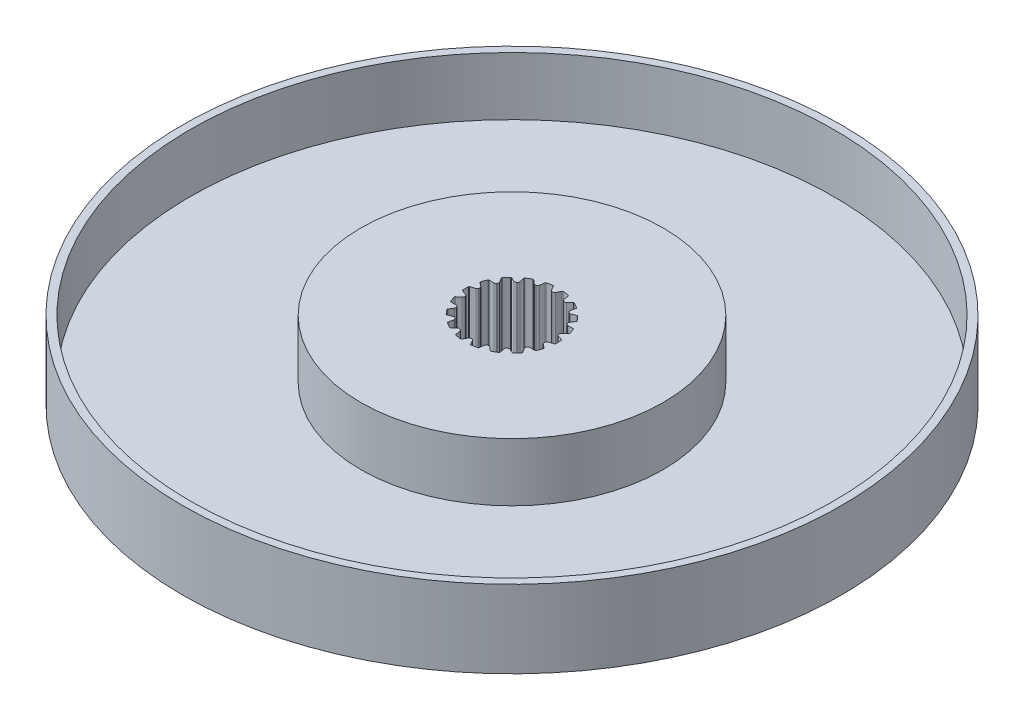
from build123d import *

# Parameters (mm, degrees)
SKETCH1_R           = 42.5
BOSS_EXTRUDE1_DEPTH = 10
SKETCH3_R           = 41.5
SKETCH3_R_2         = 19.5
CUT_EXTRUDE2_DEPTH  = 7.5
CUT_EXTRUDE4_DEPTH  = 61.930288035


with BuildPart() as part:
    # Sketch1 → Boss-Extrude1 (new body)
    with BuildSketch(Plane(origin=(0, 0, 0), x_dir=(1, 0, 0), z_dir=(0, 1, 0))):
        Circle(SKETCH1_R)
    extrude(amount=BOSS_EXTRUDE1_DEPTH)

    # Sketch3 → Cut-Extrude2 (cut)
    with BuildSketch(Plane(origin=(0, 10, 0), x_dir=(1, 0, 0), z_dir=(0, 1, 0))):
        Circle(SKETCH3_R)
        Circle(SKETCH3_R_2, mode=Mode.SUBTRACT)
    extrude(amount=-CUT_EXTRUDE2_DEPTH, mode=Mode.SUBTRACT)

    # Sketch4 → Cut-Extrude4 (cut, through all)
    with BuildSketch(Plane(origin=(0, 10, 0), x_dir=(1, 0, 0), z_dir=(0, 1, 0))):
        with BuildLine():
            Line((-0.270736898, 5.352657429), (-0.567299202, 5.910410003))
            ThreePointArc((-0.567299202, 5.910410003), (-0.608939663, 5.9519127), (-0.666705724, 5.962843573))
            ThreePointArc((-0.666705724, 5.962843573), (-1.041889066, 5.908846518), (-1.412914165, 5.831266892))
            ThreePointArc((-1.412914165, 5.831266892), (-1.463457927, 5.801238074), (-1.488392402, 5.74799642))
            Line((-1.488392402, 5.74799642), (-1.576307196, 5.122450161))
            ThreePointArc((-1.576307196, 5.122450161), (-1.629587723, 4.999913338), (-1.738369177, 4.922320281))
            Line((-1.738369177, 4.922320281), (-1.832338439, 4.888118266))
            ThreePointArc((-1.832338439, 4.888118266), (-1.965545724, 4.877634626), (-2.085126127, 4.937255215))
            Line((-2.085126127, 4.937255215), (-2.554566151, 5.359940911))
            ThreePointArc((-2.554566151, 5.359940911), (-2.607890142, 5.384698812), (-2.665911062, 5.375213317))
            ThreePointArc((-2.665911062, 5.375213317), (-3, 5.196152423), (-3.322115752, 4.996353363))
            ThreePointArc((-3.322115752, 4.996353363), (-3.359340892, 4.95084852), (-3.364561917, 4.892289638))
            Line((-3.364561917, 4.892289638), (-3.233225378, 4.274399803))
            ThreePointArc((-3.233225378, 4.274399803), (-3.241382634, 4.141029842), (-3.317065376, 4.03091077))
            Line((-3.317065376, 4.03091077), (-3.39366982, 3.966632009))
            ThreePointArc((-3.39366982, 3.966632009), (-3.515258106, 3.911221034), (-3.648018371, 3.926347156))
            Line((-3.648018371, 3.926347156), (-4.23371472, 4.162983841))
            ThreePointArc((-4.23371472, 4.162983841), (-4.292290582, 4.168010779), (-4.343568182, 4.139253006))
            ThreePointArc((-4.343568182, 4.139253006), (-4.596266659, 3.856725658), (-4.830621151, 3.55880588))
            ThreePointArc((-4.830621151, 3.55880588), (-4.850037767, 3.503313567), (-4.834915608, 3.446500522))
            Line((-4.834915608, 3.446500522), (-4.500168862, 2.910793746))
            ThreePointArc((-4.500168862, 2.910793746), (-4.462218963, 2.782677032), (-4.495674535, 2.65331393))
            Line((-4.495674535, 2.65331393), (-4.545674535, 2.56671139))
            ThreePointArc((-4.545674535, 2.56671139), (-4.640978481, 2.473056463), (-4.770905761, 2.441863683))
            Line((-4.770905761, 2.441863683), (-5.402214811, 2.463909481))
            ThreePointArc((-5.402214811, 2.463909481), (-5.45897743, 2.448599132), (-5.497326875, 2.404037693))
            ThreePointArc((-5.497326875, 2.404037693), (-5.638155725, 2.05212086), (-5.756482347, 1.692013886))
            ThreePointArc((-5.756482347, 1.692013886), (-5.755748509, 1.633227295), (-5.722107122, 1.585012579))
            Line((-5.722107122, 1.585012579), (-5.224325566, 1.196103005))
            ThreePointArc((-5.224325566, 1.196103005), (-5.144845829, 1.088692304), (-5.132038997, 0.955688272))
            Line((-5.132038997, 0.955688272), (-5.149403815, 0.857207497))
            ThreePointArc((-5.149403815, 0.857207497), (-5.206928358, 0.736604784), (-5.318351505, 0.662855412))
            Line((-5.318351505, 0.662855412), (-5.919128067, 0.467651274))
            ThreePointArc((-5.919128067, 0.467651274), (-5.967231035, 0.433850293), (-5.988026815, 0.378859955))
            ThreePointArc((-5.988026815, 0.378859955), (-6, 0), (-5.988026815, -0.378859955))
            ThreePointArc((-5.988026815, -0.378859955), (-5.967231035, -0.433850293), (-5.919128067, -0.467651274))
            Line((-5.919128067, -0.467651274), (-5.318351505, -0.662855412))
            ThreePointArc((-5.318351505, -0.662855412), (-5.206928358, -0.736604784), (-5.149403815, -0.857207497))
            Line((-5.149403815, -0.857207497), (-5.132038997, -0.955688272))
            ThreePointArc((-5.132038997, -0.955688272), (-5.144845829, -1.088692304), (-5.224325566, -1.196103005))
            Line((-5.224325566, -1.196103005), (-5.722107122, -1.585012579))
            ThreePointArc((-5.722107122, -1.585012579), (-5.755748509, -1.633227295), (-5.756482347, -1.692013886))
            ThreePointArc((-5.756482347, -1.692013886), (-5.638155725, -2.05212086), (-5.497326875, -2.404037693))
            ThreePointArc((-5.497326875, -2.404037693), (-5.45897743, -2.448599132), (-5.402214811, -2.463909481))
            Line((-5.402214811, -2.463909481), (-4.770905761, -2.441863683))
            ThreePointArc((-4.770905761, -2.441863683), (-4.640978481, -2.473056463), (-4.545674535, -2.56671139))
            Line((-4.545674535, -2.56671139), (-4.495674535, -2.65331393))
            ThreePointArc((-4.495674535, -2.65331393), (-4.462218963, -2.782677032), (-4.500168862, -2.910793746))
            Line((-4.500168862, -2.910793746), (-4.834915608, -3.446500522))
            ThreePointArc((-4.834915608, -3.446500522), (-4.850037767, -3.503313567), (-4.830621151, -3.55880588))
            ThreePointArc((-4.830621151, -3.55880588), (-4.596266659, -3.856725658), (-4.343568182, -4.139253006))
            ThreePointArc((-4.343568182, -4.139253006), (-4.292290582, -4.168010779), (-4.23371472, -4.162983841))
            Line((-4.23371472, -4.162983841), (-3.648018371, -3.926347156))
            ThreePointArc((-3.648018371, -3.926347156), (-3.515258106, -3.911221034), (-3.39366982, -3.966632009))
            Line((-3.39366982, -3.966632009), (-3.317065376, -4.03091077))
            ThreePointArc((-3.317065376, -4.03091077), (-3.241382634, -4.141029842), (-3.233225378, -4.274399803))
            Line((-3.233225378, -4.274399803), (-3.364561917, -4.892289638))
            ThreePointArc((-3.364561917, -4.892289638), (-3.359340892, -4.95084852), (-3.322115752, -4.996353363))
            ThreePointArc((-3.322115752, -4.996353363), (-3, -5.196152423), (-2.665911062, -5.375213317))
            ThreePointArc((-2.665911062, -5.375213317), (-2.607890142, -5.384698812), (-2.554566151, -5.359940911))
            Line((-2.554566151, -5.359940911), (-2.085126127, -4.937255215))
            ThreePointArc((-2.085126127, -4.937255215), (-1.965545724, -4.877634626), (-1.832338439, -4.888118266))
            Line((-1.832338439, -4.888118266), (-1.738369177, -4.922320281))
            ThreePointArc((-1.738369177, -4.922320281), (-1.629587723, -4.999913338), (-1.576307196, -5.122450161))
            Line((-1.576307196, -5.122450161), (-1.488392402, -5.74799642))
            ThreePointArc((-1.488392402, -5.74799642), (-1.463457927, -5.801238074), (-1.412914165, -5.831266892))
            ThreePointArc((-1.412914165, -5.831266892), (-1.041889066, -5.908846518), (-0.666705724, -5.962843573))
            ThreePointArc((-0.666705724, -5.962843573), (-0.608939663, -5.9519127), (-0.567299202, -5.910410003))
            Line((-0.567299202, -5.910410003), (-0.270736898, -5.352657429))
            ThreePointArc((-0.270736898, -5.352657429), (-0.178759519, -5.255733495), (-0.05, -5.22002532))
            Line((-0.05, -5.22002532), (0.05, -5.22002532))
            ThreePointArc((0.05, -5.22002532), (0.178759519, -5.255733495), (0.270736898, -5.352657429))
            Line((0.270736898, -5.352657429), (0.567299202, -5.910410003))
            ThreePointArc((0.567299202, -5.910410003), (0.608939663, -5.9519127), (0.666705724, -5.962843573))
            ThreePointArc((0.666705724, -5.962843573), (1.041889066, -5.908846518), (1.412914165, -5.831266892))
            ThreePointArc((1.412914165, -5.831266892), (1.463457927, -5.801238074), (1.488392402, -5.74799642))
            Line((1.488392402, -5.74799642), (1.576307196, -5.122450161))
            ThreePointArc((1.576307196, -5.122450161), (1.629587723, -4.999913338), (1.738369177, -4.922320281))
            Line((1.738369177, -4.922320281), (1.832338439, -4.888118266))
            ThreePointArc((1.832338439, -4.888118266), (1.965545724, -4.877634626), (2.085126127, -4.937255215))
            Line((2.085126127, -4.937255215), (2.554566151, -5.359940911))
            ThreePointArc((2.554566151, -5.359940911), (2.607890142, -5.384698812), (2.665911062, -5.375213317))
            ThreePointArc((2.665911062, -5.375213317), (3, -5.196152423), (3.322115752, -4.996353363))
            ThreePointArc((3.322115752, -4.996353363), (3.359340892, -4.95084852), (3.364561917, -4.892289638))
            Line((3.364561917, -4.892289638), (3.233225378, -4.274399803))
            ThreePointArc((3.233225378, -4.274399803), (3.241382634, -4.141029842), (3.317065376, -4.03091077))
            Line((3.317065376, -4.03091077), (3.39366982, -3.966632009))
            ThreePointArc((3.39366982, -3.966632009), (3.515258106, -3.911221034), (3.648018371, -3.926347156))
            Line((3.648018371, -3.926347156), (4.23371472, -4.162983841))
            ThreePointArc((4.23371472, -4.162983841), (4.292290582, -4.168010779), (4.343568182, -4.139253006))
            ThreePointArc((4.343568182, -4.139253006), (4.596266659, -3.856725658), (4.830621151, -3.55880588))
            ThreePointArc((4.830621151, -3.55880588), (4.850037767, -3.503313567), (4.834915608, -3.446500522))
            Line((4.834915608, -3.446500522), (4.500168862, -2.910793746))
            ThreePointArc((4.500168862, -2.910793746), (4.462218963, -2.782677032), (4.495674535, -2.65331393))
            Line((4.495674535, -2.65331393), (4.545674535, -2.56671139))
            ThreePointArc((4.545674535, -2.56671139), (4.640978481, -2.473056463), (4.770905761, -2.441863683))
            Line((4.770905761, -2.441863683), (5.402214811, -2.463909481))
            ThreePointArc((5.402214811, -2.463909481), (5.45897743, -2.448599132), (5.497326875, -2.404037693))
            ThreePointArc((5.497326875, -2.404037693), (5.638155725, -2.05212086), (5.756482347, -1.692013886))
            ThreePointArc((5.756482347, -1.692013886), (5.755748509, -1.633227295), (5.722107122, -1.585012579))
            Line((5.722107122, -1.585012579), (5.224325566, -1.196103005))
            ThreePointArc((5.224325566, -1.196103005), (5.144845829, -1.088692304), (5.132038997, -0.955688272))
            Line((5.132038997, -0.955688272), (5.149403815, -0.857207497))
            ThreePointArc((5.149403815, -0.857207497), (5.206928358, -0.736604784), (5.318351505, -0.662855412))
            Line((5.318351505, -0.662855412), (5.919128067, -0.467651274))
            ThreePointArc((5.919128067, -0.467651274), (5.967231035, -0.433850293), (5.988026815, -0.378859955))
            ThreePointArc((5.988026815, -0.378859955), (6, 0), (5.988026815, 0.378859955))
            ThreePointArc((5.988026815, 0.378859955), (5.967231035, 0.433850293), (5.919128067, 0.467651274))
            Line((5.919128067, 0.467651274), (5.318351505, 0.662855412))
            ThreePointArc((5.318351505, 0.662855412), (5.206928358, 0.736604784), (5.149403815, 0.857207497))
            Line((5.149403815, 0.857207497), (5.132038997, 0.955688272))
            ThreePointArc((5.132038997, 0.955688272), (5.144845829, 1.088692304), (5.224325566, 1.196103005))
            Line((5.224325566, 1.196103005), (5.722107122, 1.585012579))
            ThreePointArc((5.722107122, 1.585012579), (5.755748509, 1.633227295), (5.756482347, 1.692013886))
            ThreePointArc((5.756482347, 1.692013886), (5.638155725, 2.05212086), (5.497326875, 2.404037693))
            ThreePointArc((5.497326875, 2.404037693), (5.45897743, 2.448599132), (5.402214811, 2.463909481))
            Line((5.402214811, 2.463909481), (4.770905761, 2.441863683))
            ThreePointArc((4.770905761, 2.441863683), (4.640978481, 2.473056463), (4.545674535, 2.56671139))
            Line((4.545674535, 2.56671139), (4.495674535, 2.65331393))
            ThreePointArc((4.495674535, 2.65331393), (4.462218963, 2.782677032), (4.500168862, 2.910793746))
            Line((4.500168862, 2.910793746), (4.834915608, 3.446500522))
            ThreePointArc((4.834915608, 3.446500522), (4.850037767, 3.503313567), (4.830621151, 3.55880588))
            ThreePointArc((4.830621151, 3.55880588), (4.596266659, 3.856725658), (4.343568182, 4.139253006))
            ThreePointArc((4.343568182, 4.139253006), (4.292290582, 4.168010779), (4.23371472, 4.162983841))
            Line((4.23371472, 4.162983841), (3.648018371, 3.926347156))
            ThreePointArc((3.648018371, 3.926347156), (3.515258106, 3.911221034), (3.39366982, 3.966632009))
            Line((3.39366982, 3.966632009), (3.317065376, 4.03091077))
            ThreePointArc((3.317065376, 4.03091077), (3.241382634, 4.141029842), (3.233225378, 4.274399803))
            Line((3.233225378, 4.274399803), (3.364561917, 4.892289638))
            ThreePointArc((3.364561917, 4.892289638), (3.359340892, 4.95084852), (3.322115752, 4.996353363))
            ThreePointArc((3.322115752, 4.996353363), (3, 5.196152423), (2.665911062, 5.375213317))
            ThreePointArc((2.665911062, 5.375213317), (2.607890142, 5.384698812), (2.554566151, 5.359940911))
            Line((2.554566151, 5.359940911), (2.085126127, 4.937255215))
            ThreePointArc((2.085126127, 4.937255215), (1.965545724, 4.877634626), (1.832338439, 4.888118266))
            Line((1.832338439, 4.888118266), (1.738369177, 4.922320281))
            ThreePointArc((1.738369177, 4.922320281), (1.629587723, 4.999913338), (1.576307196, 5.122450161))
            Line((1.576307196, 5.122450161), (1.488392402, 5.74799642))
            ThreePointArc((1.488392402, 5.74799642), (1.463457927, 5.801238074), (1.412914165, 5.831266892))
            ThreePointArc((1.412914165, 5.831266892), (1.041889066, 5.908846518), (0.666705724, 5.962843573))
            ThreePointArc((0.666705724, 5.962843573), (0.608939663, 5.9519127), (0.567299202, 5.910410003))
            Line((0.567299202, 5.910410003), (0.270736898, 5.352657429))
            ThreePointArc((0.270736898, 5.352657429), (0.178759519, 5.255733495), (0.05, 5.22002532))
            Line((0.05, 5.22002532), (-0.05, 5.22002532))
            ThreePointArc((-0.05, 5.22002532), (-0.178759519, 5.255733495), (-0.270736898, 5.352657429))
        make_face()
    extrude(amount=-CUT_EXTRUDE4_DEPTH, mode=Mode.SUBTRACT)


solid = part.part
